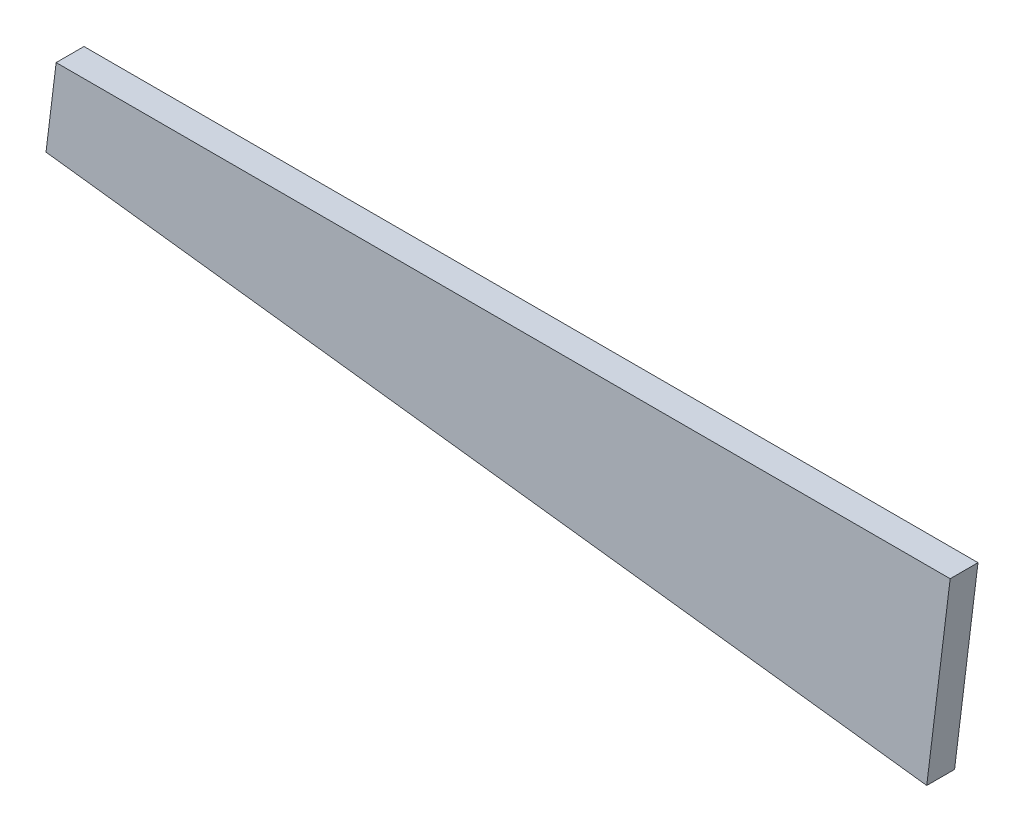
from build123d import *

# Parameters (mm, degrees)
BOSS_EXTRUDE1_DEPTH = 6.35
CUT_EXTRUDE1_DEPTH  = 229.196782971


with BuildPart() as part:
    # Sketch1 → Boss-Extrude1 (new body)
    with BuildSketch(Plane.XY):
        Polygon((-195.316766477, -62.659206724), (-182.616766477, -62.659206724), (-182.616766477, -69.009206724), (-112.766766477, -69.009206724), (-112.766766477, -62.659206724), (-74.666766477, -62.659206724), (-74.666766477, -69.009206724), (7.883233523, -69.009206724), (2.537900009, -112.543454638), (-198.412247799, -87.869878976), align=None)
    extrude(amount=-BOSS_EXTRUDE1_DEPTH)

    # Sketch2 → Cut-Extrude1 (cut, through all)
    with BuildSketch(Plane.XY):
        Polygon((-195.316766477, -62.659206724), (-74.666766477, -62.659206724), (-74.666766477, -69.009206724), (-196.096448438, -69.009206724), align=None)
    extrude(amount=-CUT_EXTRUDE1_DEPTH, mode=Mode.SUBTRACT)


solid = part.part
